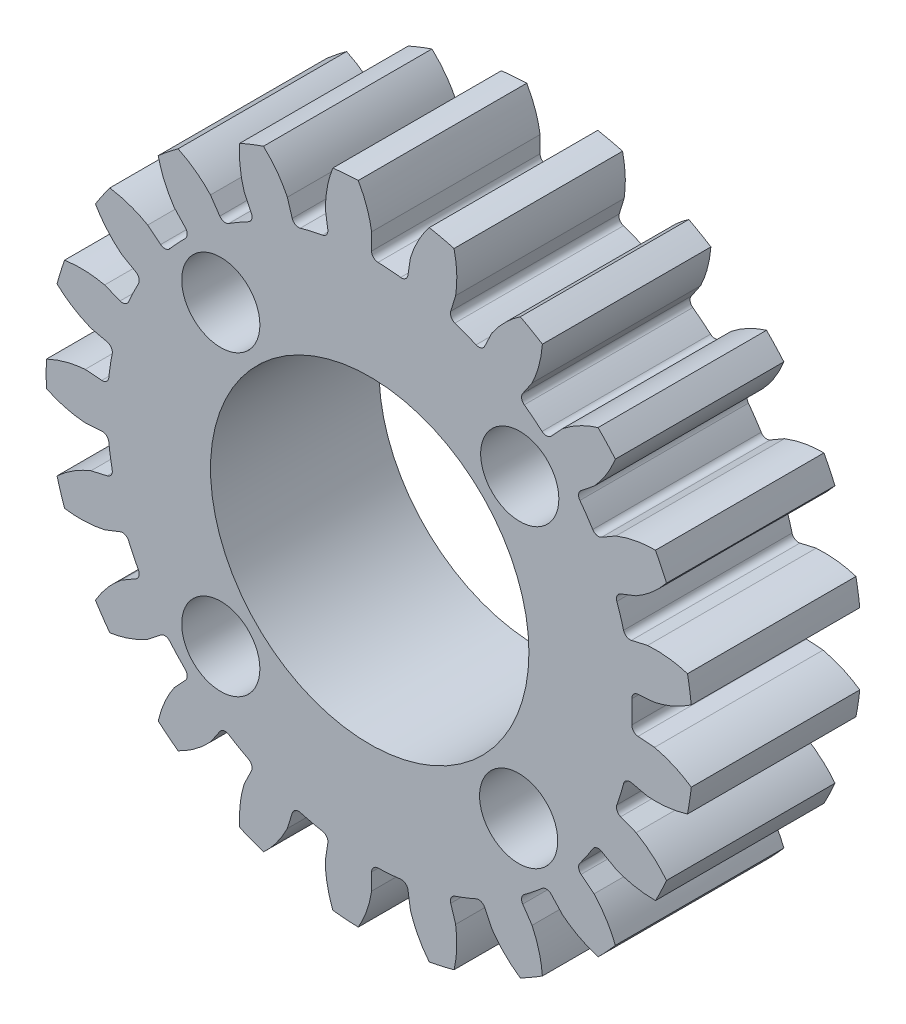
from build123d import *

# Parameters (mm, degrees)
SKETCH1_R                 = 12.192
BOSS_EXTRUDE1_DEPTH       = 6.35
CUT_EXTRUDE1_DEPTH        = 19.374227276
FILLET1_R                 = 0.2493645
CIRPATTERN1_COUNT         = 21
FILLET1_OF_CIRPATTERN1_R  = 0.2493645
SKETCH5_R                 = 6
CUT_EXTRUDE2_DEPTH        = 19.369155693
F_4_CLEARANCE_HOLE1_D     = 2.9464
F_4_CLEARANCE_HOLE1_DEPTH = 51.562
F_4_CLEARANCE_HOLE1_TIP   = 0.885187864


with BuildPart() as part:
    # Sketch1 → Boss-Extrude1 (new body)
    with BuildSketch(Plane.XY):
        Circle(SKETCH1_R)
    extrude(amount=-BOSS_EXTRUDE1_DEPTH)

    # Sketch4 → Cut-Extrude1 (cut, through all)
    with BuildSketch(Plane.XY):
        with BuildLine():
            Line((0.069920096, 10.758313445), (0.069920096, 9.887761121))
            ThreePointArc((0.069920096, 9.887761121), (0.738933513, 9.860359327), (1.404558602, 9.787743557))
            Line((1.404558602, 9.787743557), (1.534307995, 10.648572485))
            add(Edge.make_bspline(
                [(2.886089324, 12.639183121), (1.892992221, 11.805052485), (1.534307995, 10.648572485)],
                knots=[0, 0, 0, 1, 1, 1], degree=2))
            ThreePointArc((2.886089324, 12.639183121), (0.96884114, 12.928256201), (-0.970077074, 12.928163521))
            add(Edge.make_bspline(
                [(-0.970077074, 12.928163521), (-0.112393105, 11.955335692), (0.069920096, 10.758313445)],
                knots=[0, 0, 0, 1, 1, 1], degree=2))
        make_face()
    cut_extrude1 = extrude(amount=-CUT_EXTRUDE1_DEPTH, mode=Mode.SUBTRACT)

    # Fillet1
    fillet1_edges = [part.edges().sort_by_distance(p)[0] for p in [
        (1.404558602, 9.787743557, -3.175),
        (0.069920096, 9.887761121, -3.175),
    ]]
    fillet(fillet1_edges, radius=FILLET1_R)

    # CirPattern1: Cut-Extrude1 ×21 about axis
    cirpattern1_axis = Axis((0, 0, -6.35), (0, 0, 1))
    for i in range(1, CIRPATTERN1_COUNT):
        add(cut_extrude1.rotate(cirpattern1_axis, i * 360 / CIRPATTERN1_COUNT), mode=Mode.SUBTRACT)

    # Fillet1 of CirPattern1
    fillet1_of_cirpattern1_edges = [part.edges().sort_by_distance(p)[0] for p in [
        (-1.542830055, 9.766902489, -3.175),
        (-2.847655011, 9.469084947, -3.175),
        (-4.353131491, 8.878229273, -3.175),
        (-5.512203474, 8.209039022, -3.175),
        (-6.77663809, 7.200686425, -3.175),
        (-7.686968468, 6.219583955, -3.175),
        (-8.598010657, 4.883330988, -3.175),
        (-9.17871258, 3.677491559, -3.175),
        (-9.655412245, 2.132070163, -3.175),
        (-9.8548878, 0.8086379, -3.175),
        (-9.854888083, -0.808634452, -3.175),
        (-9.655412991, -2.132066786, -3.175),
        (-9.178713867, -3.677488348, -3.175),
        (-8.598012365, -4.883327981, -3.175),
        (-7.686970644, -6.219581265, -3.175),
        (-6.776640609, -7.200684054, -3.175),
        (-5.512206346, -8.209037094, -3.175),
        (-4.353134597, -8.87822775, -3.175),
        (-2.847658324, -9.469083951, -3.175),
        (-1.542833472, -9.766901949, -3.175),
        (0.069916637, -9.887761145, -3.175),
        (1.404555178, -9.787744048, -3.175),
        (2.981279198, -9.42786737, -3.175),
        (4.227142936, -8.938902136, -3.175),
        (5.627742019, -8.130266205, -3.175),
        (6.674130494, -7.295799541, -3.175),
        (7.774155265, -6.110255209, -3.175),
        (8.528092269, -5.00443314, -3.175),
        (9.229800699, -3.547321223, -3.175),
        (9.62429562, -2.268400893, -3.175),
        (9.865337836, -0.669192179, -3.175),
        (9.865338071, 0.669188728, -3.175),
        (9.624296414, 2.268397526, -3.175),
        (9.22980194, 3.547317994, -3.175),
        (8.52809402, 5.004430157, -3.175),
        (7.774157402, 6.110252489, -3.175),
        (6.674133047, 7.295797206, -3.175),
        (5.627744863, 8.130264236, -3.175),
        (4.227146064, 8.938900657, -3.175),
        (2.981282496, 9.427866327, -3.175),
    ]]
    fillet(fillet1_of_cirpattern1_edges, radius=FILLET1_OF_CIRPATTERN1_R)

    # Sketch5 → Cut-Extrude2 (cut, through all)
    with BuildSketch(Plane.XY):
        Circle(SKETCH5_R)
    extrude(amount=-CUT_EXTRUDE2_DEPTH, mode=Mode.SUBTRACT)

    # #4 Clearance Hole1
    with Locations(Plane.XY):
        with Locations((-5.612660076, 5.612660076), (5.654237965, 5.570771876), (5.612660076, -5.612660076), (-5.612660076, -5.612660076)):
            Hole(F_4_CLEARANCE_HOLE1_D / 2, depth=F_4_CLEARANCE_HOLE1_DEPTH)
            with Locations((0, 0, -(F_4_CLEARANCE_HOLE1_DEPTH + F_4_CLEARANCE_HOLE1_TIP / 2))):  # 118° drill point
                Cone(0, F_4_CLEARANCE_HOLE1_D / 2, F_4_CLEARANCE_HOLE1_TIP, mode=Mode.SUBTRACT)


solid = part.part
